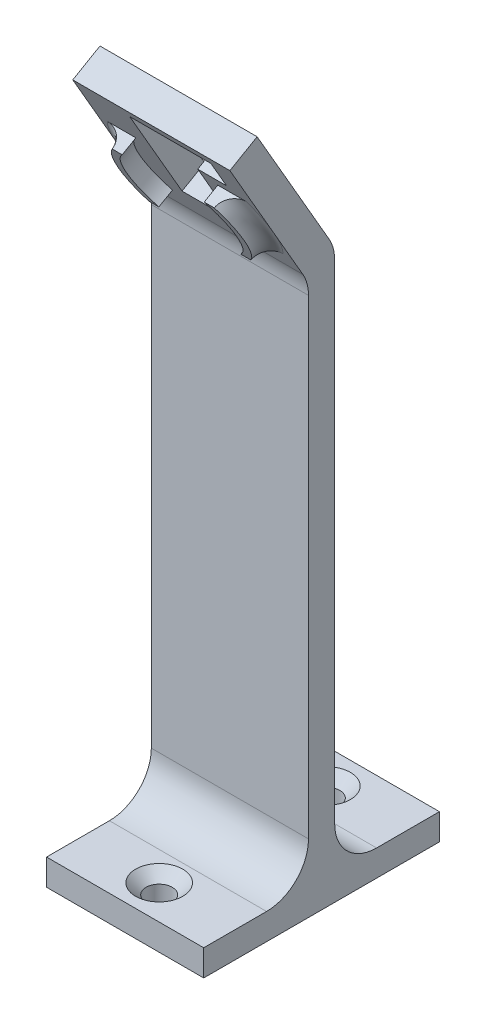
from build123d import *

# Parameters (mm, degrees)
SKETCH1_W           = 30
SKETCH1_H           = 45
BOSS_EXTRUDE1_DEPTH = 5
SKETCH2_W           = 30
SKETCH2_H           = 5
BOSS_EXTRUDE2_DEPTH = 100
BOSS_EXTRUDE3_DEPTH = 30
FILLET1_R           = 8
SKETCH4_R           = 2.5
CUT_EXTRUDE1_DEPTH  = 132.785002923
CHAMFER1_SIZE       = 2
SKETCH5_W           = 26
SKETCH5_H           = 25
CUT_EXTRUDE2_DEPTH  = 1
BOSS_EXTRUDE5_DEPTH = 3
CUT_EXTRUDE3_DEPTH  = 129.19281303
SKETCH7_R           = 0.848419625
BOSS_EXTRUDE4_DEPTH = 1
FILLET2_R           = 3


with BuildPart() as part:
    # Sketch1 → Boss-Extrude1 (new body)
    with BuildSketch(Plane(origin=(0, 0, 0), x_dir=(1, 0, 0), z_dir=(0, 1, 0))):
        Rectangle(SKETCH1_W, SKETCH1_H)
    extrude(amount=BOSS_EXTRUDE1_DEPTH)

    # Sketch2 → Boss-Extrude2 (add)
    with BuildSketch(Plane(origin=(0, 5, 0), x_dir=(1, 0, 0), z_dir=(0, 1, 0))):
        Rectangle(SKETCH2_W, SKETCH2_H)
    extrude(amount=BOSS_EXTRUDE2_DEPTH)

    # Sketch3 → Boss-Extrude3 (add)
    with BuildSketch(Plane(origin=(15, 0, 0), x_dir=(0, 0, -1), z_dir=(1, 0, 0))):
        Polygon((-2.5, 105), (-17.5, 130.980762114), (-12.303847577, 133.980762114), (2.5, 108.339745962), (2.5, 105), align=None)
    extrude(amount=-BOSS_EXTRUDE3_DEPTH)

    # Fillet1
    fillet1_edges = [part.edges().sort_by_distance(p)[0] for p in [
        (0, 5, -2.5),
        (0, 5, 2.5),
        (0, 105, 2.5),
        (0, 108.339745962, -2.5),
    ]]
    fillet(fillet1_edges, radius=FILLET1_R)

    # Sketch4 → Cut-Extrude1 (cut, through all)
    with BuildSketch(Plane(origin=(0, 5, 0), x_dir=(1, 0, 0), z_dir=(0, 1, 0))):
        with Locations(Location((0, 16, 0), (0, 0, 270))):
            Circle(SKETCH4_R)
        with Locations(Location((0, -16, 0), (0, 0, 270))):
            Circle(SKETCH4_R)
    extrude(amount=-CUT_EXTRUDE1_DEPTH, mode=Mode.SUBTRACT)

    # Chamfer1
    chamfer1_edges = [part.edges().sort_by_distance(p)[0] for p in [
        (0, 5, -18.5),
        (0, 5, 13.5),
    ]]
    chamfer(chamfer1_edges, length=CHAMFER1_SIZE)

    # Sketch5 → Cut-Extrude2 (cut)
    with BuildSketch(Plane(origin=(0, 28.167468245, -48.787486121), x_dir=(1, 0, 0), z_dir=(0, 0.4999999999999981, -0.8660254037844397))):
        with Locations((0, -108.45061659)):
            Rectangle(SKETCH5_W, SKETCH5_H)
    extrude(amount=-CUT_EXTRUDE2_DEPTH, mode=Mode.SUBTRACT)

    # Sketch8 → Boss-Extrude5 (add)
    with BuildSketch(Plane(origin=(0, 25.167468245, -43.591333699), x_dir=(1, 0, 0), z_dir=(0, -0.49999999999999784, 0.8660254037844399))):
        with BuildLine():
            Line((-9.746794345, 112.45061659), (-7.826237921, 112.45061659))
            ThreePointArc((-7.826237921, 112.45061659), (-10.5, 105.45061659), (-7.826237921, 98.45061659))
            Line((-7.826237921, 98.45061659), (-9.746794345, 98.45061659))
            ThreePointArc((-9.746794345, 98.45061659), (-12, 105.45061659), (-9.746794345, 112.45061659))
        make_face()
        with BuildLine():
            Line((7.826237921, 98.45061659), (9.746794345, 98.45061659))
            ThreePointArc((9.746794345, 98.45061659), (12, 105.45061659), (9.746794345, 112.45061659))
            Line((9.746794345, 112.45061659), (7.826237921, 112.45061659))
            ThreePointArc((7.826237921, 112.45061659), (10.5, 105.45061659), (7.826237921, 98.45061659))
        make_face()
    extrude(amount=BOSS_EXTRUDE5_DEPTH)

    # Sketch6 → Cut-Extrude3 (cut, through all)
    with BuildSketch(Plane(origin=(0, 25.167468245, -43.591333699), x_dir=(1, 0, 0), z_dir=(0, -0.49999999999999784, 0.8660254037844399))):
        Polygon((-5, 100.45061659), (5, 100.45061659), (5, 114.45061659), (10.5, 114.45061659), (10.5, 120.45061659), (-5, 120.45061659), align=None)
    extrude(amount=-CUT_EXTRUDE3_DEPTH, mode=Mode.SUBTRACT)

    # Sketch7 → Boss-Extrude4 (add)
    with BuildSketch(Plane(origin=(0, 27.667468245, -47.921460718), x_dir=(1, 0, 0), z_dir=(0, 0.4999999999999983, -0.8660254037844397))):
        with Locations(Location((10.5, -105.95061659, 0), (0, 0, 270))):
            Circle(SKETCH7_R)
        with Locations(Location((-10.5, -118.45061659, 0), (0, 0, 270))):
            Circle(SKETCH7_R)
    extrude(amount=BOSS_EXTRUDE4_DEPTH)

    # Fillet2
    fillet2_edges = [part.edges().sort_by_distance(p)[0] for p in [
        (12, 116.490381057, 9.133974596),
        (-12, 116.490381057, 9.133974596),
    ]]
    fillet(fillet2_edges, radius=FILLET2_R - 0.0001)  # a hair under: the kernel refuses the full size


solid = part.part
